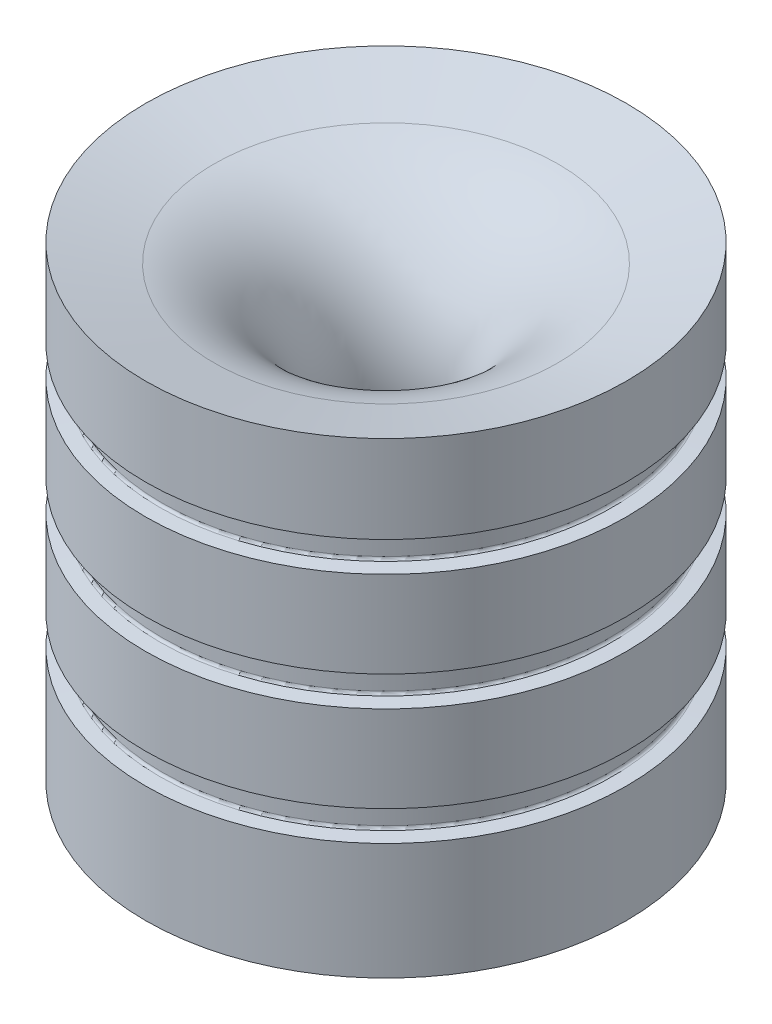
from build123d import *

# Parameters (mm, degrees)
LPATTERN1_COUNT = 3
LPATTERN1_PITCH = 20


with BuildPart() as part:
    # Sketch1 → Revolve1 (revolve)
    with BuildSketch(Plane.XY):
        with BuildLine():
            Line((41.275, 80.186715559), (41.275, 0))
            Line((41.275, 0), (23.27236431, 0))
            Line((23.27236431, 0), (11.160928516, 45.200493734))
            ThreePointArc((11.160928516, 45.200493734), (13.758339502, 64.929788907), (29.545704827, 77.04386039))
            Line((29.545704827, 77.04386039), (41.275, 80.186715559))
        make_face()
    revolve(axis=Axis((0, 11.203886574, 0), (0, 1, 0)))

    # Sketch3 → Groove for AS 568-234, O-Ring1 (revolve, cut)
    with BuildSketch(Plane(origin=(0, 11.203886574, 0), x_dir=(0, 0, -1), z_dir=(-1, 0, 0))):
        with BuildLine():
            Line((38.861359272, -9.01505737), (41.3639, -8.796113426))
            Line((41.3639, -8.796113426), (41.3639, -13.983801313))
            Line((41.3639, -13.983801313), (38.861359272, -13.76485737))
            ThreePointArc((38.861359272, -13.76485737), (38.572380224, -13.622348674), (38.4556, -13.322048826))
            Line((38.4556, -13.322048826), (38.4556, -9.457865913))
            ThreePointArc((38.4556, -9.457865913), (38.572380224, -9.157566066), (38.861359272, -9.01505737))
        make_face()
    groove_for_as_568_234_o_ring1 = revolve(axis=Axis((0, -38.796113426, 0), (0, 1, 0)), mode=Mode.SUBTRACT)

    # LPattern1: Groove for AS 568-234, O-Ring1 ×3
    with Locations(*[(0, i * LPATTERN1_PITCH, 0) for i in range(1, LPATTERN1_COUNT)]):
        add(groove_for_as_568_234_o_ring1, mode=Mode.SUBTRACT)


solid = part.part
